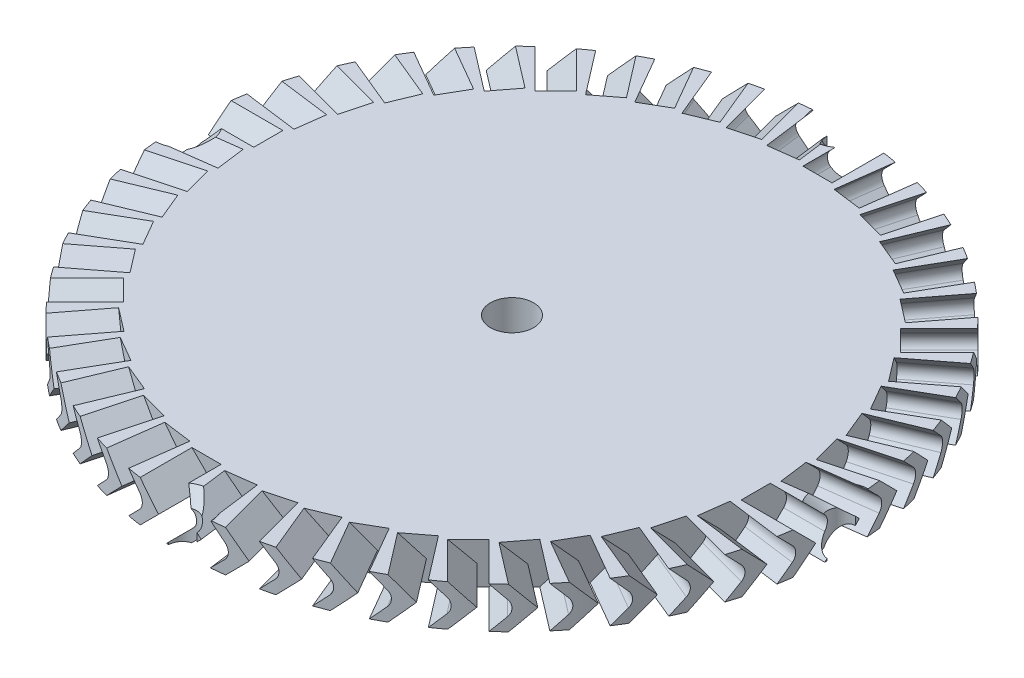
from build123d import *

# Parameters (mm, degrees)
SKETCH1_R           = 76.2
SKETCH1_R_2         = 5
BOSS_EXTRUDE1_DEPTH = 9.525
BLADE_GAPS_DEPTH    = 12.7
CIRPATTERN1_COUNT   = 48
CIRPATTERN2_COUNT   = 4


with BuildPart() as part:
    # Sketch1 → Boss-Extrude1 (new body)
    with BuildSketch(Plane(origin=(0, 0, 0), x_dir=(1, 0, 0), z_dir=(0, 1, 0))):
        Circle(SKETCH1_R)
        Circle(SKETCH1_R_2, mode=Mode.SUBTRACT)
    extrude(amount=BOSS_EXTRUDE1_DEPTH)

    # Sketch2 → Blade Gaps (cut)
    with BuildSketch(Plane.XY.offset(76.2)):
        with BuildLine():
            Line((-3.776153955, 0), (-0.697451977, 3.078701977))
            ThreePointArc((-0.697451977, 3.078701977), (0, 4.7625), (-0.697451977, 6.446298023))
            Line((-0.697451977, 6.446298023), (-3.776153955, 9.525))
            Line((-3.776153955, 9.525), (-10.511346045, 9.525))
            Line((-10.511346045, 9.525), (-5.748846045, 4.7625))
            Line((-5.748846045, 4.7625), (-10.511346045, 0))
            Line((-10.511346045, 0), (-3.776153955, 0))
        make_face()
    blade_gaps = extrude(amount=-BLADE_GAPS_DEPTH, mode=Mode.SUBTRACT)

    # CirPattern1: Blade Gaps ×48 about axis
    cirpattern1_axis = Axis((0, 9.525, 0), (0, -1, 0))
    for i in range(1, CIRPATTERN1_COUNT):
        add(blade_gaps.rotate(cirpattern1_axis, i * 360 / CIRPATTERN1_COUNT), mode=Mode.SUBTRACT)

    # Sketch3 → CSK for 1/4 Flat Head Machine Screw (100)1 (revolve, cut)
    with BuildSketch(Plane(origin=(0, 9.525, 76.2), x_dir=(0, 0, 1), z_dir=(1, 0, 0))):
        Polygon((0, 0), (0, 14.661148974), (3.2639, 12.7), (3.2639, 2.664141329), (6.4389, 0), align=None)
    csk_for_1_4_flat_head_machine_screw_100 = revolve(axis=Axis((0, 15.875, 76.2), (0, -1, 0)), mode=Mode.SUBTRACT)

    # CirPattern2: CSK for 1/4 Flat Head Machine Screw (100)1 ×4 about axis
    cirpattern2_axis = Axis((0, 9.525, 0), (0, -1, 0))
    for i in range(1, CIRPATTERN2_COUNT):
        add(csk_for_1_4_flat_head_machine_screw_100.rotate(cirpattern2_axis, i * 360 / CIRPATTERN2_COUNT), mode=Mode.SUBTRACT)


solid = part.part
